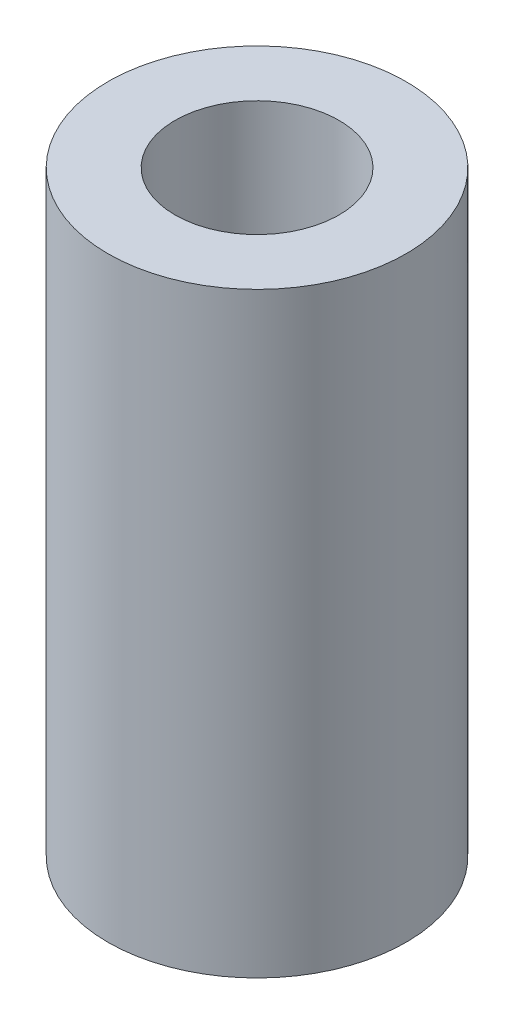
from build123d import *

# Parameters (mm, degrees)
SKETCH1_R           = 5
SKETCH1_R_2         = 2.75
BOSS_EXTRUDE1_DEPTH = 20


with BuildPart() as part:
    # Sketch1 → Boss-Extrude1 (new body)
    with BuildSketch(Plane(origin=(0, 0, 0), x_dir=(1, 0, 0), z_dir=(0, 1, 0))):
        Circle(SKETCH1_R)
        Circle(SKETCH1_R_2, mode=Mode.SUBTRACT)
    extrude(amount=BOSS_EXTRUDE1_DEPTH)


solid = part.part
